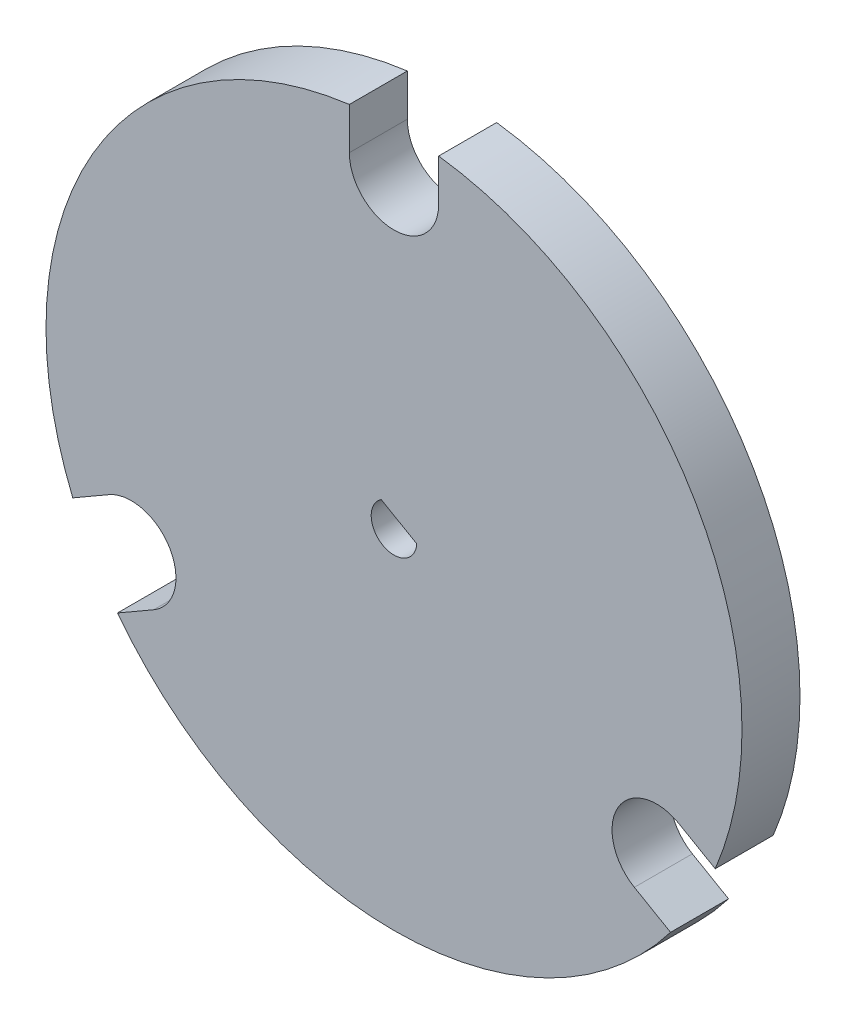
from build123d import *

# Parameters (mm, degrees)
SKETCH1_R           = 38.1
BOSS_EXTRUDE1_DEPTH = 6.35
CUT_EXTRUDE1_DEPTH  = 55.254423783
CUT_EXTRUDE2_DEPTH  = 55.254423783


with BuildPart() as part:
    # Sketch1 → Boss-Extrude1 (new body)
    with BuildSketch(Plane.XY):
        Circle(SKETCH1_R)
    extrude(amount=BOSS_EXTRUDE1_DEPTH)

    # Sketch2 → Cut-Extrude1 (cut, through all)
    with BuildSketch(Plane.XY.offset(6.35)):
        with BuildLine():
            Line((-4.8895, 33.2105), (-4.8895, 37.784954542))
            ThreePointArc((-4.8895, 37.784954542), (0, 38.1), (4.8895, 37.784954542))
            Line((4.8895, 37.784954542), (4.8895, 33.2105))
            ThreePointArc((4.8895, 33.2105), (0, 28.321), (-4.8895, 33.2105))
        make_face()
        with BuildLine():
            Line((31.205886672, -12.370818788), (35.167480514, -14.658046059))
            ThreePointArc((35.167480514, -14.658046059), (32.995567884, -19.05), (30.277980514, -23.126908483))
            Line((30.277980514, -23.126908483), (26.316386672, -20.839681212))
            ThreePointArc((26.316386672, -20.839681212), (24.526705461, -14.1605), (31.205886672, -12.370818788))
        make_face()
        with BuildLine():
            Line((-26.316386672, -20.839681212), (-30.277980514, -23.126908483))
            ThreePointArc((-30.277980514, -23.126908483), (-32.995567884, -19.05), (-35.167480514, -14.658046059))
            Line((-35.167480514, -14.658046059), (-31.205886672, -12.370818788))
            ThreePointArc((-31.205886672, -12.370818788), (-24.526705461, -14.1605), (-26.316386672, -20.839681212))
        make_face()
    extrude(amount=-CUT_EXTRUDE1_DEPTH, mode=Mode.SUBTRACT)

    # Sketch3 → Cut-Extrude2 (cut, through all)
    with BuildSketch(Plane.XY.offset(6.35)):
        with BuildLine():
            Line((2.493419526, -0.181270696), (-1.403694791, 2.068729304))
            ThreePointArc((-1.403694791, 2.068729304), (-1.25, -2.165063509), (2.493419526, -0.181270696))
        make_face()
    extrude(amount=-CUT_EXTRUDE2_DEPTH, mode=Mode.SUBTRACT)


solid = part.part
